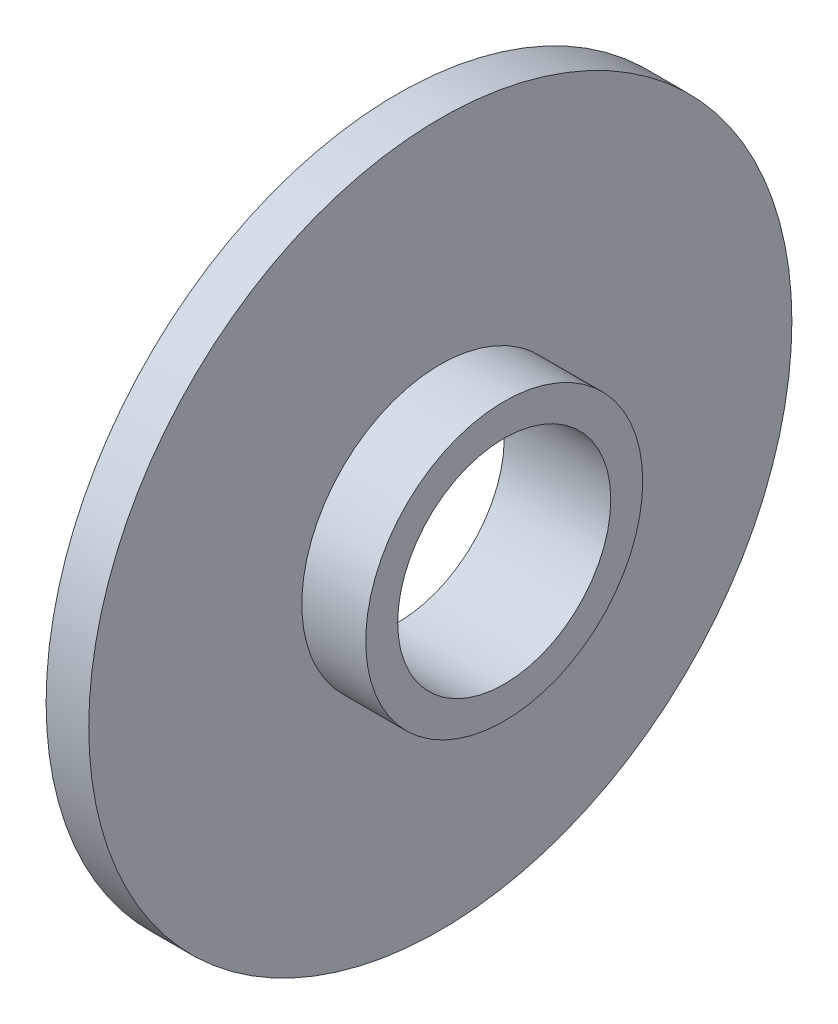
from build123d import *


with BuildPart() as part:
    # Sketch1 → Revolve1 (revolve)
    with BuildSketch(Plane(origin=(0, 0, 0), x_dir=(1, 0, 0), z_dir=(0, 1, 0))):
        Polygon((-1, 16.5), (1, 16.5), (1, 6.5), (4, 6.5), (4, 5), (-1, 5), align=None)
    revolve(axis=Axis((88.99, 0, 0), (-1, 0, 0)))


solid = part.part
